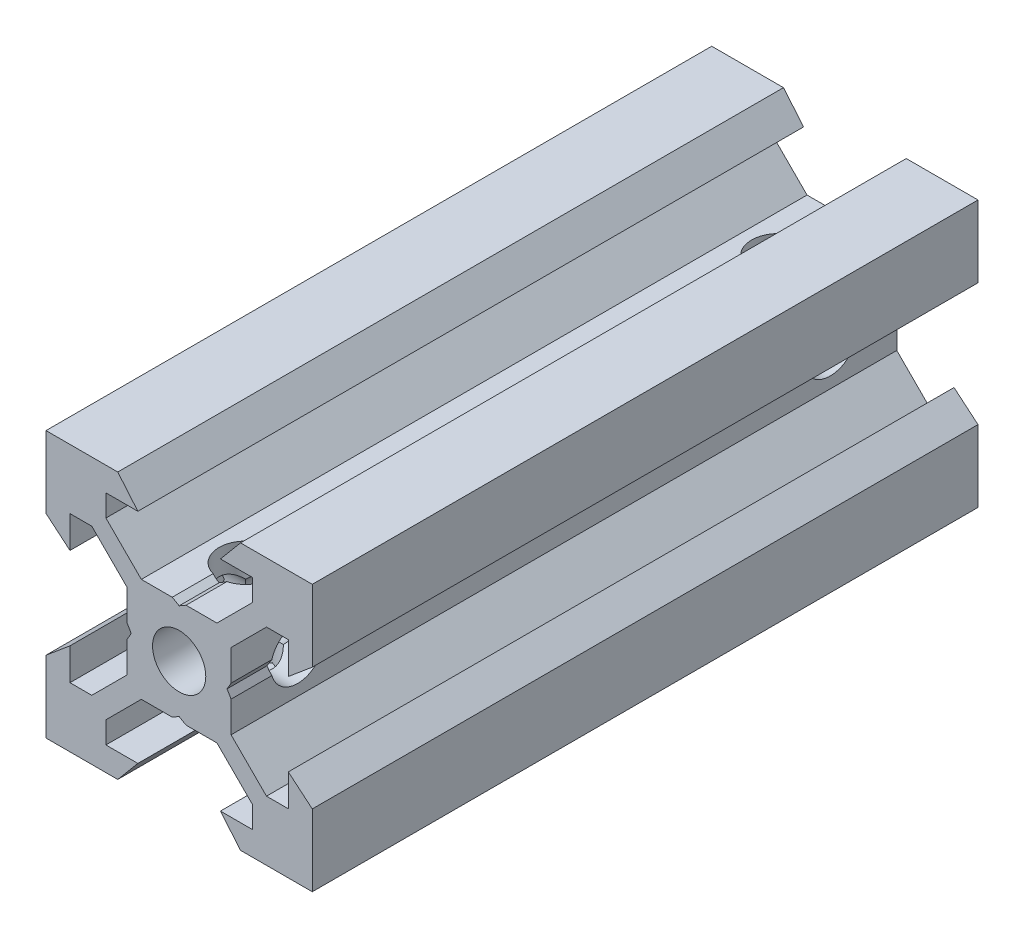
from build123d import *

# Parameters (mm, degrees)
SKETCH1_R               = 2
BOSS_EXTRUDE1_DEPTH     = 50
CUT_EXTRUDE1_DEPTH      = 53.850827808
CUT_EXTRUDE1_DEPTH_BACK = 53.850827808
SKETCH2_R               = 2
CUT_EXTRUDE2_DEPTH      = 53.850827808
CUT_EXTRUDE2_DEPTH_BACK = 53.850827808
SKETCH3_R               = 2


with BuildPart() as part:
    # Sketch1 → Boss-Extrude1 (new body)
    with BuildSketch(Plane.XY):
        Polygon((10, 4.610379336), (10, 10), (4.610379336, 10), (3.1, 8.2), (5.5, 8.2), (5.5, 6.560660172), (2.839339828, 3.9), (0.519615242, 3.9), (0, 3.6), (-0.519615242, 3.9), (-2.839339828, 3.9), (-5.5, 6.560660172), (-5.5, 8.2), (-3.1, 8.2), (-4.610379336, 10), (-10, 10), (-10, 4.610379336), (-8.2, 3.1), (-8.2, 5.5), (-6.560660172, 5.5), (-3.9, 2.839339828), (-3.9, 0.519615242), (-3.6, 0), (-3.9, -0.519615242), (-3.9, -2.839339828), (-6.560660172, -5.5), (-8.2, -5.5), (-8.2, -3.1), (-10, -4.610379336), (-10, -10), (-4.610379336, -10), (-3.1, -8.2), (-5.5, -8.2), (-5.5, -6.560660172), (-2.839339828, -3.9), (-0.519615242, -3.9), (0, -3.6), (0.519615242, -3.9), (2.839339828, -3.9), (5.5, -6.560660172), (5.5, -8.2), (3.1, -8.2), (4.610379336, -10), (10, -10), (10, -4.610379336), (8.2, -3.1), (8.2, -5.5), (6.560660172, -5.5), (3.9, -2.839339828), (3.9, -0.519615242), (3.6, 0), (3.9, 0.519615242), (3.9, 2.839339828), (6.560660172, 5.5), (8.2, 5.5), (8.2, 3.1), align=None)
        Circle(SKETCH1_R, mode=Mode.SUBTRACT)
    extrude(amount=BOSS_EXTRUDE1_DEPTH)

    # Sketch2 → Cut-Extrude1 (cut, two sides: drawn at the far end of the back side and taken through both)
    with BuildSketch(Plane(origin=(0, -3.9, 0), x_dir=(-1, 0, 0), z_dir=(0, -1, 0)).offset(-CUT_EXTRUDE1_DEPTH_BACK)):
        with Locations((0, -5)):
            Circle(SKETCH2_R)
        with Locations((0, -45)):
            Circle(SKETCH2_R)
    extrude(amount=CUT_EXTRUDE1_DEPTH + CUT_EXTRUDE1_DEPTH_BACK, mode=Mode.SUBTRACT)

    # Sketch3 → Cut-Extrude2 (cut, two sides: drawn at the far end of the back side and taken through both)
    with BuildSketch(Plane(origin=(3.9, 0, 0), x_dir=(0, 0, -1), z_dir=(1, 0, 0)).offset(-CUT_EXTRUDE2_DEPTH_BACK)):
        with Locations((-45, 0)):
            Circle(SKETCH3_R)
        with Locations((-5, 0)):
            Circle(SKETCH3_R)
    extrude(amount=CUT_EXTRUDE2_DEPTH + CUT_EXTRUDE2_DEPTH_BACK, mode=Mode.SUBTRACT)


solid = part.part
